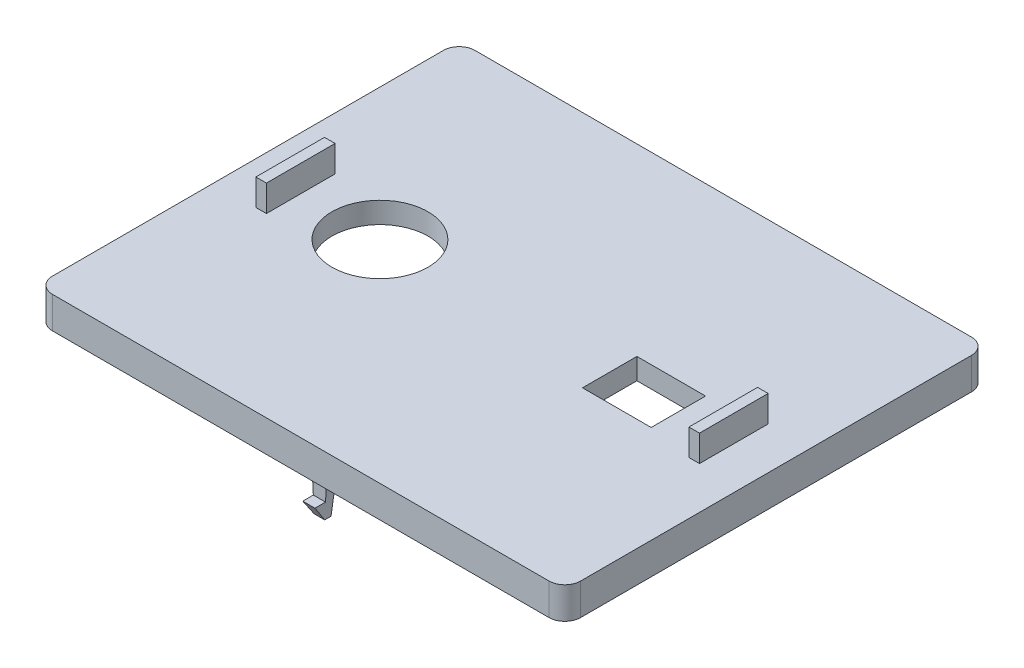
from build123d import *

# Parameters (mm, degrees)
SKETCH1_W           = 100
SKETCH1_H           = 80
BOSS_EXTRUDE1_DEPTH = 7
SKETCH2_W           = 90
SKETCH2_H           = 70
CUT_EXTRUDE1_DEPTH  = 3
SKETCH3_OUTSIDE_W   = 127.65
SKETCH3_OUTSIDE_H   = 107.65
SKETCH3_OUTSIDE_W_2 = 94.6
SKETCH3_OUTSIDE_H_2 = 74.6
CUT_EXTRUDE2_DEPTH  = 1
SKETCH4_W           = 2
SKETCH4_H           = 13
BOSS_EXTRUDE2_DEPTH = 5
SKETCH5_W           = 13
SKETCH5_H           = 10.3
CUT_EXTRUDE3_DEPTH  = 65.412731661
SKETCH6_R           = 9.1
CUT_EXTRUDE4_DEPTH  = 65.412731661
FILLET1_R           = 3
SNAP_START          = -36.217722162
SNAP_HOOK2_DEPTH    = 1.2
SNAP_START_2        = -36.063805806
SNAP_HOOK2_2_DEPTH  = 1.063805806
SNAP_START_3        = -1.403030484
SNAP_HOOK2_3_DEPTH  = 2.314446676
SNAP_START_4        = -1.822292718
SNAP_HOOK2_4_DEPTH  = 3.152971144
SNAP_START_5        = -35
SNAP_HOOK2_5_DEPTH  = 2
SNAP_START_6        = -39
SNAP_HOOK2_6_DEPTH  = 4


with BuildPart() as part:
    # Sketch1 → Boss-Extrude1 (new body)
    with BuildSketch(Plane(origin=(0, 0, 0), x_dir=(1, 0, 0), z_dir=(0, 1, 0))):
        Rectangle(SKETCH1_W, SKETCH1_H)
    extrude(amount=-BOSS_EXTRUDE1_DEPTH)

    # Sketch2 → Cut-Extrude1 (cut)
    with BuildSketch(Plane.XZ.offset(7)):
        Rectangle(SKETCH2_W, SKETCH2_H)
    extrude(amount=-CUT_EXTRUDE1_DEPTH, mode=Mode.SUBTRACT)

    # Sketch3 outside → Cut-Extrude2 (cut)
    with BuildSketch(Plane(origin=(0, -7, 0), x_dir=(-1, 0, 0), z_dir=(0, -1, 0))):
        Rectangle(SKETCH3_OUTSIDE_W, SKETCH3_OUTSIDE_H)
        Rectangle(SKETCH3_OUTSIDE_W_2, SKETCH3_OUTSIDE_H_2, mode=Mode.SUBTRACT)
    extrude(amount=-CUT_EXTRUDE2_DEPTH, mode=Mode.SUBTRACT)

    # Sketch4 → Boss-Extrude2 (add)
    with BuildSketch(Plane(origin=(0, 0, 0), x_dir=(1, 0, 0), z_dir=(0, 1, 0))):
        with Locations((-41, 0)):
            Rectangle(SKETCH4_W, SKETCH4_H)
    boss_extrude2 = extrude(amount=BOSS_EXTRUDE2_DEPTH)

    # Mirror2: Boss-Extrude2 across plane
    add(boss_extrude2.mirror(Plane(origin=(0, 0, 0), x_dir=(0, 0, 1), z_dir=(1, 0, 0))))

    # Sketch5 → Cut-Extrude3 (cut, through all)
    with BuildSketch(Plane(origin=(0, 0, 0), x_dir=(1, 0, 0), z_dir=(0, 1, 0))):
        with Locations((25, 0)):
            Rectangle(SKETCH5_W, SKETCH5_H)
    extrude(amount=-CUT_EXTRUDE3_DEPTH, mode=Mode.SUBTRACT)

    # Sketch6 → Cut-Extrude4 (cut, through all)
    with BuildSketch(Plane(origin=(0, 0, 0), x_dir=(1, 0, 0), z_dir=(0, 1, 0))):
        with Locations(Location((-25, 0, 0), (0, 0, 270))):
            Circle(SKETCH6_R)
    extrude(amount=-CUT_EXTRUDE4_DEPTH, mode=Mode.SUBTRACT)

    # Fillet1
    fillet1_edges = [part.edges().sort_by_distance(p)[0] for p in [
        (50, -3, -40),
        (-50, -3, -40),
        (-50, -3, 40),
        (50, -3, 40),
    ]]
    fillet(fillet1_edges, radius=FILLET1_R)

    # Snap Hook2: read off the stored shape, not the designer's step
    # Snap Hook2 outline → Snap Hook2 (add)
    with BuildSketch(Plane.XY.offset(SNAP_START)):
        Polygon((-1.245807146, -15), (0.754192854, -15), (1.173455088, -7), (-1.66506938, -7), align=None)
    snap_hook2 = extrude(amount=SNAP_HOOK2_DEPTH)

    # Snap Hook2 2 outline → Snap Hook2 2 (add)
    with BuildSketch(Plane.XY.offset(SNAP_START_2)):
        Polygon((-1.66506938, -7), (-1.403030484, -12), (0.911416192, -12), (1.173455088, -7), align=None)
    snap_hook2_2 = extrude(amount=SNAP_HOOK2_2_DEPTH)

    # Snap Hook2 3 outline → Snap Hook2 3 (add)
    with BuildSketch(Plane.YZ.offset(SNAP_START_3)):
        Polygon((-12, -36.217722162), (-15, -36.217722162), (-12, -38.217722162), align=None)
        Polygon((-4, -35), (-4, -33.917722162), (-15, -35.017722162), (-12, -35.017722162), (-12, -35), align=None)
    snap_hook2_3 = extrude(amount=SNAP_HOOK2_3_DEPTH)

    # Snap Hook2 4 outline → Snap Hook2 4 (add)
    with BuildSketch(Plane.YZ.offset(SNAP_START_4)):
        Polygon((-4, -35), (-4, -33.917722162), (-15, -35.017722162), (-12, -35.017722162), (-12, -35), align=None)
    snap_hook2_4 = extrude(amount=SNAP_HOOK2_4_DEPTH)

    # Snap Hook2 5 outline → Snap Hook2 5 (cut)
    with BuildSketch(Plane.XY.offset(SNAP_START_5)):
        Polygon((-1.822292718, -4), (-1.822292718, -16), (-1.193399367, -16), (-1.245807146, -15), align=None)
        Polygon((0.754192854, -15), (0.701785075, -16), (1.330678426, -16), (1.330678426, -4), align=None)
    snap_hook2_5 = extrude(amount=SNAP_HOOK2_5_DEPTH, mode=Mode.SUBTRACT)

    # Snap Hook2 6 outline → Snap Hook2 6 (cut)
    with BuildSketch(Plane.XY.offset(SNAP_START_6)):
        Polygon((-1.822292718, -16), (-1.193399367, -16), (-1.245807146, -15), (-1.403030484, -12), (-1.822292718, -12), align=None)
        Polygon((0.754192854, -15), (0.701785075, -16), (1.330678426, -16), (1.330678426, -12), (0.911416192, -12), align=None)
    snap_hook2_6 = extrude(amount=SNAP_HOOK2_6_DEPTH, mode=Mode.SUBTRACT)

    # Mirror4: Snap Hook2, Snap Hook2 2, Snap Hook2 3, Snap Hook2 4, Snap Hook2 5, Snap Hook2 6 across plane
    add(snap_hook2.mirror(Plane.XY))
    add(snap_hook2_2.mirror(Plane.XY))
    add(snap_hook2_3.mirror(Plane.XY))
    add(snap_hook2_4.mirror(Plane.XY))
    add(snap_hook2_5.mirror(Plane.XY), mode=Mode.SUBTRACT)
    add(snap_hook2_6.mirror(Plane.XY), mode=Mode.SUBTRACT)


solid = part.part
